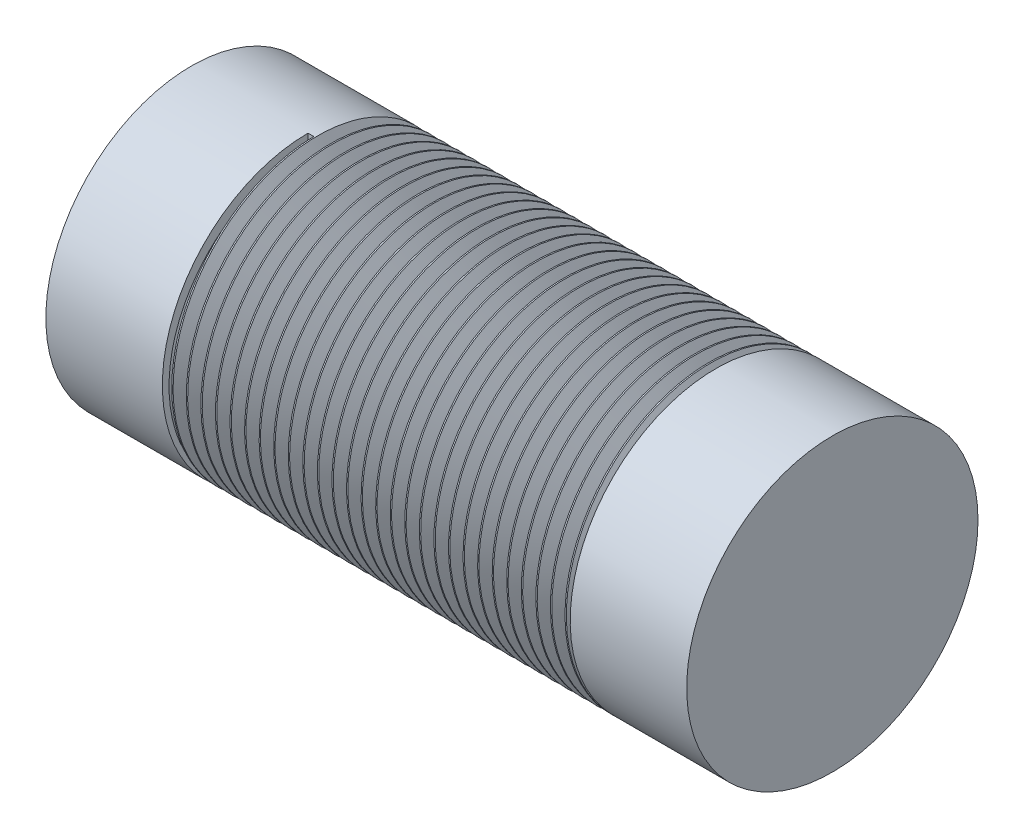
from build123d import *

# Parameters (mm, degrees)
SKETCH1_R           = 25
BOSS_EXTRUDE1_DEPTH = 70
CUT_SWEEP1_PITCH    = 2.5
BOSS_EXTRUDE2_START = -20
SKETCH1_3_R         = 25
BOSS_EXTRUDE2_DEPTH = 20
SKETCH3_R           = 25
BOSS_EXTRUDE3_DEPTH = 20


with BuildPart() as part:
    # Sketch1 → Boss-Extrude1 (new body)
    with BuildSketch(Plane(origin=(0, 0, 0), x_dir=(0, 0, -1), z_dir=(1, 0, 0))):
        Circle(SKETCH1_R)
    extrude(amount=BOSS_EXTRUDE1_DEPTH)

    # Cut-Sweep1: arcs per turn and ends read off the stored shape
    # Cut-Sweep1: the profile of 3DSketch1 screwed along a right-hand helix through 30 turns, 10 arcs to a turn; built about Z, then put on its axis
    cut_sweep1_z = Axis((0, 0, 0), (0, 0, 1))
    cut_sweep1_corners = [(23.023555969, 0, -0.158404577), (26.250779385, 0, 1.717888107), (26.250779385, 0, -1.995670373)]
    with BuildLine(mode=Mode.PRIVATE) as cut_sweep1_profile:
        Line(cut_sweep1_corners[0], cut_sweep1_corners[1])
        Line(cut_sweep1_corners[1], cut_sweep1_corners[2])
        Line(cut_sweep1_corners[2], cut_sweep1_corners[0])
    cut_sweep1_cap = Face(cut_sweep1_profile.wire())
    cut_sweep1_turn_angles = [0, 18, 36, 54, 72, 90, 108, 126, 144, 162, 180, 198, 216, 234, 252, 270, 288, 306, 324, 342, 360]
    cut_sweep1_turn_weights = [1, 0.9510565162951535, 1, 0.9510565162951535, 1, 0.9510565162951535, 1, 0.9510565162951535, 1, 0.9510565162951535, 1, 0.9510565162951535, 1, 0.9510565162951535, 1, 0.9510565162951535, 1, 0.9510565162951535, 1, 0.9510565162951535, 1]
    cut_sweep1_turn_rails = [Edge.make_bspline([Vector(p[0], p[1], 0).rotate(cut_sweep1_z, cut_sweep1_turn_angles[k]) / cut_sweep1_turn_weights[k] + Vector(0, 0, p[2] + CUT_SWEEP1_PITCH * cut_sweep1_turn_angles[k] / 360) for k in range(21)], [0, 0, 0, 1, 1, 2, 2, 3, 3, 4, 4, 5, 5, 6, 6, 7, 7, 8, 8, 9, 9, 10, 10, 10], 2, cut_sweep1_turn_weights) for p in cut_sweep1_corners]
    cut_sweep1_turn_sides = [Face.make_surface_from_curves(cut_sweep1_turn_rails[p[0]], cut_sweep1_turn_rails[p[1]]) for p in [(0, 1), (1, 2), (2, 0)]]
    cut_sweep1 = Plane(origin=(0, 0, 0), x_dir=(0, 1, 0), z_dir=(1, 0, 0)) * Solid(Shell([*[p.moved(Location((0, 0, CUT_SWEEP1_PITCH * i))) for i in range(30) for p in cut_sweep1_turn_sides], cut_sweep1_cap, cut_sweep1_cap.rotate(cut_sweep1_z, 10800).moved(Location((0, 0, CUT_SWEEP1_PITCH * 10800 / 360)))]))
    add(cut_sweep1, mode=Mode.SUBTRACT)

    # Sketch1<3> → Boss-Extrude2 (add)
    with BuildSketch(Plane(origin=(0, 0, 0), x_dir=(0, 0, -1), z_dir=(1, 0, 0)).offset(BOSS_EXTRUDE2_START)):
        Circle(SKETCH1_3_R)
    extrude(amount=BOSS_EXTRUDE2_DEPTH)

    # Sketch3 → Boss-Extrude3 (add)
    with BuildSketch(Plane(origin=(70, 0, 0), x_dir=(0, 0, -1), z_dir=(1, 0, 0))):
        Circle(SKETCH3_R)
    extrude(amount=BOSS_EXTRUDE3_DEPTH)


solid = part.part
